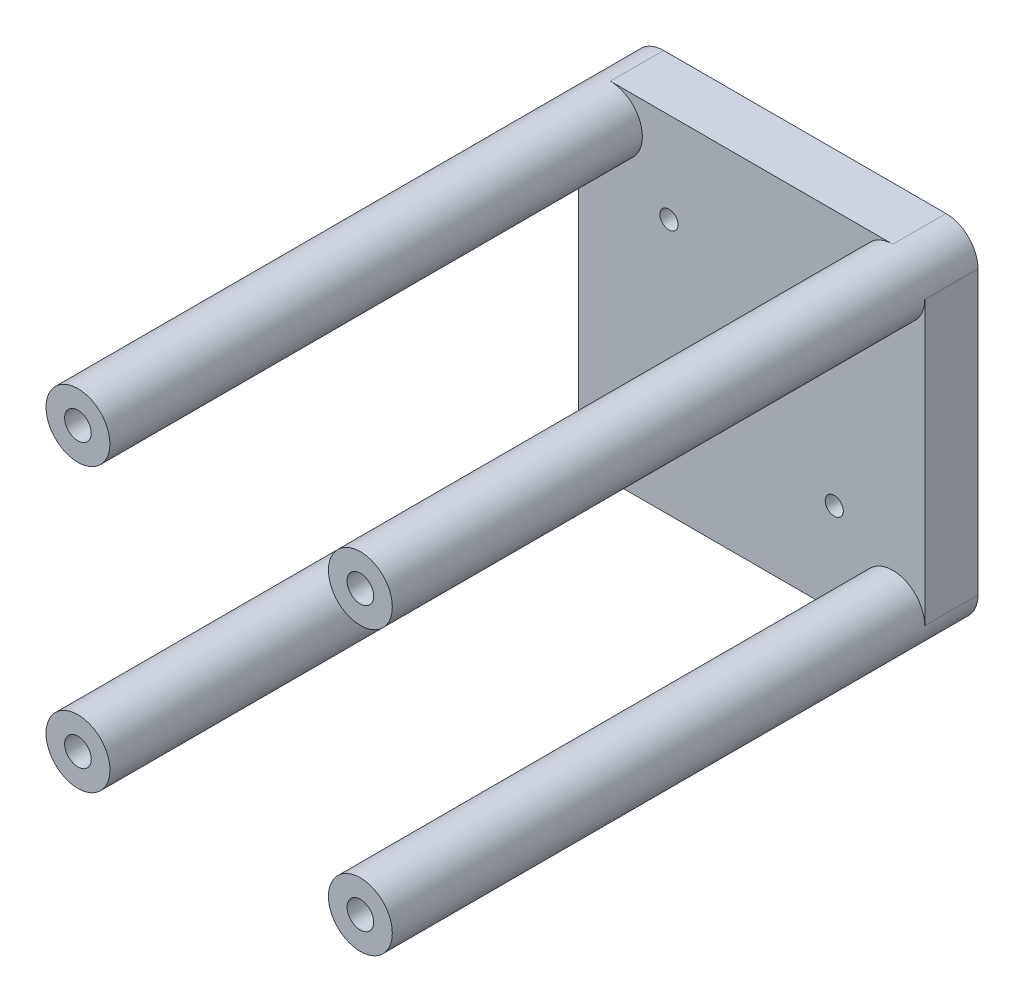
from build123d import *
from build123d.topology import SkipClean

# Parameters (mm, degrees)
SCHIZZO1_W                   = 65.04
SCHIZZO1_H                   = 65.04
ESTRUSIONE_ESTRUSIONE2_DEPTH = 10
RACCORDO1_R                  = 6
FORO_PER_VITE_M6_1_D         = 6.6
FORO_PER_VITE_M6_1_DEPTH     = 10
FORO_PER_VITE_M6_1_TIP       = 1.982840043
FORO_PER_VITE_M3_3_D         = 3.4
FORO_PER_VITE_M3_3_DEPTH     = 10
FORO_PER_VITE_M3_3_TIP       = 1.021463052
ESTRUSIONE_ESTRUSIONE3_START = 100
SCHIZZO16_R                  = 6
ESTRUSIONE_ESTRUSIONE3_DEPTH = 100
FORO_0_15_5_1_D              = 5
FORO_0_15_5_1_DEPTH          = 8
RIPETIZIONECIRCOLARE3_COUNT  = 4


with BuildPart() as part:
    # Schizzo1 → Estrusione-Estrusione2 (new body)
    with BuildSketch(Plane(origin=(0, 0, 0), x_dir=(0, 1, 0), z_dir=(0, 0, 1))):
        Rectangle(SCHIZZO1_W, SCHIZZO1_H)
    extrude(amount=ESTRUSIONE_ESTRUSIONE2_DEPTH)

    # Raccordo1
    raccordo1_edges = [part.edges().sort_by_distance(p)[0] for p in [
        (32.52, -32.52, 5),
        (32.52, 32.52, 5),
        (-32.52, 32.52, 5),
        (-32.52, -32.52, 5),
    ]]
    fillet(raccordo1_edges, radius=RACCORDO1_R)

    # Foro per Vite M6-1
    with Locations(Plane.XY.offset(10)):
        with Locations((0, 0)):
            Hole(FORO_PER_VITE_M6_1_D / 2, depth=FORO_PER_VITE_M6_1_DEPTH)
            with Locations((0, 0, -(FORO_PER_VITE_M6_1_DEPTH + FORO_PER_VITE_M6_1_TIP / 2))):  # 118° drill point
                Cone(0, FORO_PER_VITE_M6_1_D / 2, FORO_PER_VITE_M6_1_TIP, mode=Mode.SUBTRACT)

    # Foro per Vite M3-3
    with Locations(Plane.XY.offset(10)):
        with Locations((0, 0), (15.52, 15.52), (-15.52, -15.52), (-15.52, 15.52), (15.52, -15.52)):
            Hole(FORO_PER_VITE_M3_3_D / 2, depth=FORO_PER_VITE_M3_3_DEPTH)
            with Locations((0, 0, -(FORO_PER_VITE_M3_3_DEPTH + FORO_PER_VITE_M3_3_TIP / 2))):  # 118° drill point
                Cone(0, FORO_PER_VITE_M3_3_D / 2, FORO_PER_VITE_M3_3_TIP, mode=Mode.SUBTRACT)

    # Schizzo16 → Estrusione-Estrusione3 (add)
    with BuildSketch(Plane.XY.offset(10).offset(ESTRUSIONE_ESTRUSIONE3_START)):
        with Locations((-26.52, 26.52)):
            Circle(SCHIZZO16_R)
    estrusione_estrusione3 = extrude(amount=-ESTRUSIONE_ESTRUSIONE3_DEPTH)

    # Foro Ø0.15 (5)-1
    with Locations(Plane.XY.offset(110)):
        with Locations((-26.52, 26.52)):
            foro_0_15_5_1 = Hole(FORO_0_15_5_1_D / 2, depth=FORO_0_15_5_1_DEPTH)

    # RipetizioneCircolare3: Estrusione-Estrusione3, Foro Ø0.15 (5)-1 ×4 about axis
    with SkipClean():  # the faces are left unmerged after this step: merging them gives an invalid solid
        ripetizionecircolare3_axis = Axis((0, 0, 10), (0, 0, 1))
        add([estrusione_estrusione3.rotate(ripetizionecircolare3_axis, i * 360 / RIPETIZIONECIRCOLARE3_COUNT) for i in range(1, RIPETIZIONECIRCOLARE3_COUNT)])
        add([foro_0_15_5_1.rotate(ripetizionecircolare3_axis, i * 360 / RIPETIZIONECIRCOLARE3_COUNT) for i in range(1, RIPETIZIONECIRCOLARE3_COUNT)], mode=Mode.SUBTRACT)


solid = part.part
